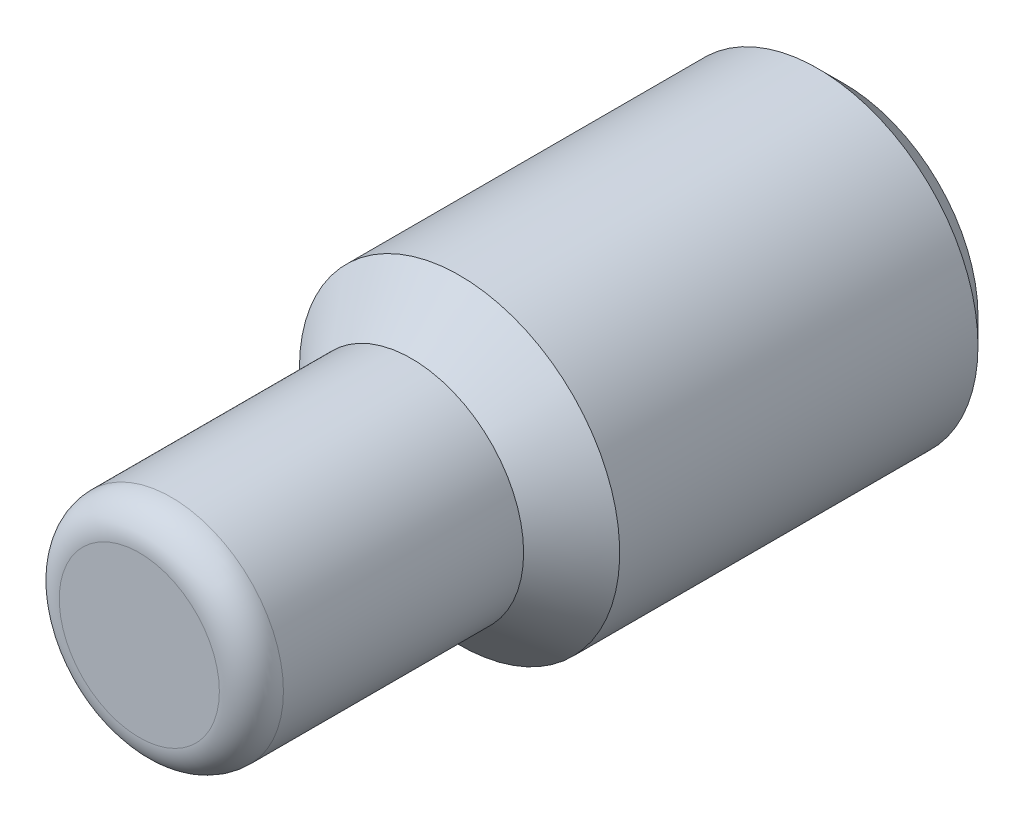
from build123d import *

# Parameters (mm, degrees)
SKETCH_1_R      = 3.5
EXTRUDE_1_DEPTH = 22
FILLET_1_R      = 1
SKETCH_2_R      = 5
EXTRUDE_2_DEPTH = 14
CHAMFER_1_SIZE  = 2


# Read off the part's stored shape, not the designer's step: M10 机械螺纹 螺柱1
with BuildPart() as part:
    # 草图1 → 凸台-拉伸1 (new body)
    with BuildSketch(Plane.XY):
        Circle(SKETCH_1_R)
    extrude(amount=EXTRUDE_1_DEPTH)

    # 圆角1
    fillet_1_edges = [part.edges().sort_by_distance(p)[0] for p in [
        (-3.5, 0, 22),
    ]]
    fillet(fillet_1_edges, radius=FILLET_1_R)

    # 草图2 → 凸台-拉伸2 (add)
    with BuildSketch(Plane(origin=(0, 0, 0), x_dir=(-1, 0, 0), z_dir=(0, 0, -1))):
        Circle(SKETCH_2_R)
    extrude(amount=-EXTRUDE_2_DEPTH)

    # M10 机械螺纹 螺柱1 outline → M10 机械螺纹 螺柱1 (revolve, cut)
    with BuildSketch(Plane.XZ):
        Polygon((5, 0.812), (4.188, 0), (5, 0), align=None)
    revolve(axis=Axis((0, 0, 0), (0, 0, 1)), mode=Mode.SUBTRACT)

    # 倒角1
    # the kernel refuses this chamfer: 2 mm, written as the material it takes off along each edge
    with BuildSketch(Plane(origin=(0, 0, 14), x_dir=(-1, 0, 0), z_dir=(0, -1, 0))) as chamfer_1_piece_1_section:
        Polygon((5, CHAMFER_1_SIZE), (5 - CHAMFER_1_SIZE, 0), (5, 0), align=None)
    chamfer_1_piece_1 = revolve(axis=Axis((0, 0, 14), (0, 0, -1)), mode=Mode.PRIVATE)
    chamfer_1_piece_1 = chamfer_1_piece_1 - Plane(origin=(0, 0, 12.748861674), x_dir=(1, 0, 0), z_dir=(0, 0, -1)) * Cylinder(3.5, 20, mode=Mode.PRIVATE)
    add(chamfer_1_piece_1, mode=Mode.SUBTRACT)


solid = part.part
